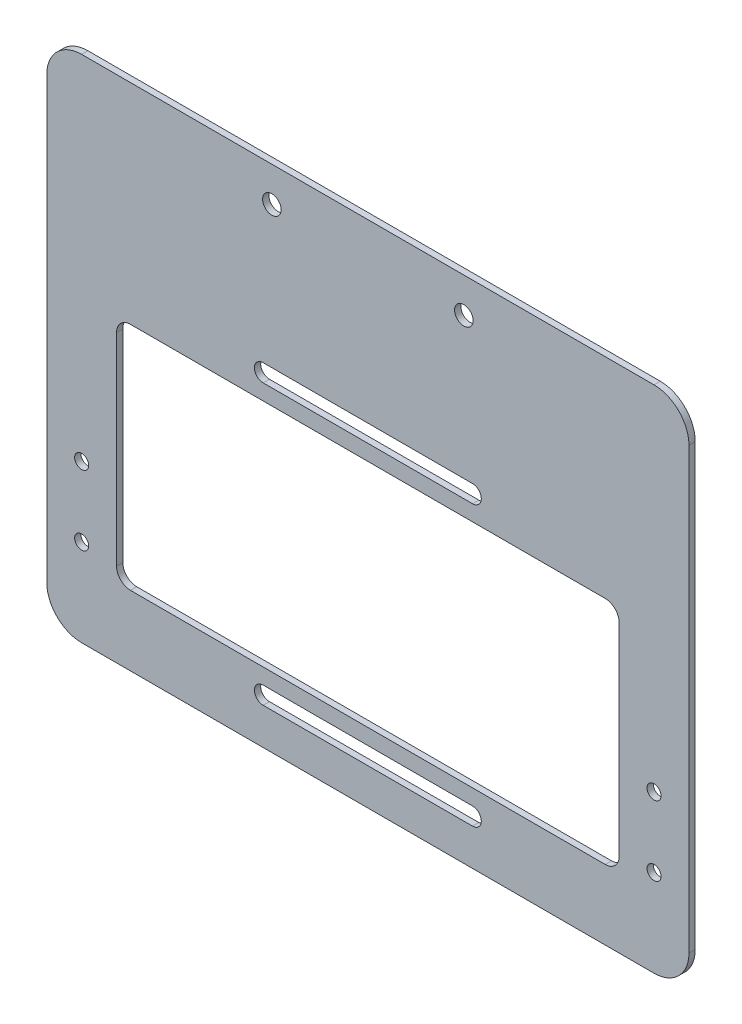
from build123d import *

# Parameters (mm, degrees)
SKETCH1_W               = 233.68
SKETCH1_H               = 185.42
BOSS_EXTRUDE1_DEPTH     = 2.286
CUT_EXTRUDE1_DEPTH      = 150.170893595
F_1_4_CLEARANCE_HOLE2_D = 6.7564
FILLET1_R               = 12.7
SKETCH9_R               = 2.5527
CUT_EXTRUDE2_DEPTH      = 150.170893595


with BuildPart() as part:
    # Sketch1 → Boss-Extrude1 (new body)
    with BuildSketch(Plane.XY):
        Rectangle(SKETCH1_W, SKETCH1_H)
        with BuildLine():
            Line((-86.36, 16.51), (86.36, 16.51))
            ThreePointArc((86.36, 16.51), (89.952102448, 15.022102448), (91.44, 11.43))
            Line((91.44, 11.43), (91.44, -62.23))
            ThreePointArc((91.44, -62.23), (89.952102448, -65.822102448), (86.36, -67.31))
            Line((86.36, -67.31), (-86.36, -67.31))
            ThreePointArc((-86.36, -67.31), (-89.952102448, -65.822102448), (-91.44, -62.23))
            Line((-91.44, -62.23), (-91.44, 11.43))
            ThreePointArc((-91.44, 11.43), (-89.952102448, 15.022102448), (-86.36, 16.51))
        make_face(mode=Mode.SUBTRACT)
    extrude(amount=BOSS_EXTRUDE1_DEPTH)

    # Sketch2 → Cut-Extrude1 (cut, through all)
    with BuildSketch(Plane.XY.offset(2.286)):
        with BuildLine():
            Line((38.1, 22.225), (-38.1, 22.225))
            ThreePointArc((-38.1, 22.225), (-41.275, 25.4), (-38.1, 28.575))
            Line((-38.1, 28.575), (38.1, 28.575))
            ThreePointArc((38.1, 28.575), (41.275, 25.4), (38.1, 22.225))
        make_face()
        with BuildLine():
            Line((38.1, -73.025), (-38.1, -73.025))
            ThreePointArc((-38.1, -73.025), (-41.275, -76.2), (-38.1, -79.375))
            Line((-38.1, -79.375), (38.1, -79.375))
            ThreePointArc((38.1, -79.375), (41.275, -76.2), (38.1, -73.025))
        make_face()
    extrude(amount=-CUT_EXTRUDE1_DEPTH, mode=Mode.SUBTRACT)

    # 1/4 Clearance Hole2 (through all)
    with Locations(Plane.XY.offset(2.286)):
        with Locations((-34.925, 80.01), (34.925, 80.01)):
            Hole(F_1_4_CLEARANCE_HOLE2_D / 2)

    # Fillet1
    fillet1_edges = [part.edges().sort_by_distance(p)[0] for p in [
        (-116.84, 92.71, 1.143),
        (116.84, 92.71, 1.143),
        (-116.84, -92.71, 1.143),
        (116.84, -92.71, 1.143),
    ]]
    fillet(fillet1_edges, radius=FILLET1_R)

    # Sketch9 → Cut-Extrude2 (cut, through all)
    with BuildSketch(Plane.XY.offset(2.286)):
        with Locations((-104.14, -60.96)):
            Circle(SKETCH9_R)
        with Locations((104.14, -60.96)):
            Circle(SKETCH9_R)
        with Locations((104.14, -35.56)):
            Circle(SKETCH9_R)
        with Locations((-104.14, -35.56)):
            Circle(SKETCH9_R)
    extrude(amount=-CUT_EXTRUDE2_DEPTH, mode=Mode.SUBTRACT)


solid = part.part
